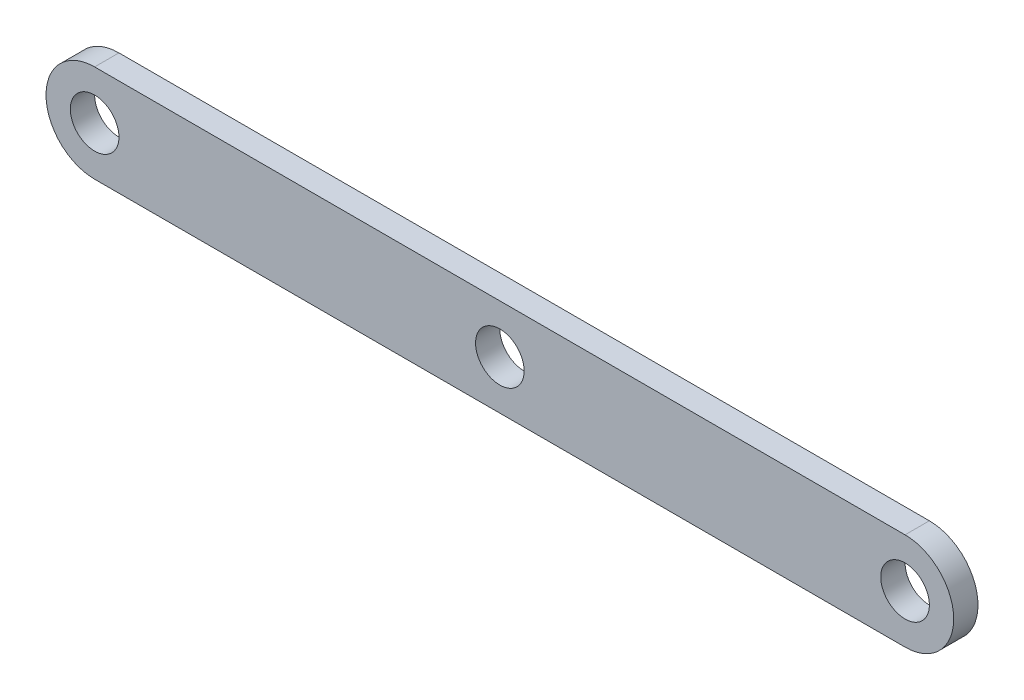
from build123d import *

# Parameters (mm, degrees)
SKETCH1_R           = 3
BOSS_EXTRUDE1_DEPTH = 3


with BuildPart() as part:
    # Sketch1 → Boss-Extrude1 (new body)
    with BuildSketch(Plane.XY):
        with BuildLine():
            Line((-50, 6), (50, 6))
            ThreePointArc((50, 6), (56, 0), (50, -6))
            Line((50, -6), (-50, -6))
            ThreePointArc((-50, -6), (-56, 0), (-50, 6))
        make_face()
        with Locations((-50, 0)):
            Circle(SKETCH1_R, mode=Mode.SUBTRACT)
        with Locations((50, 0)):
            Circle(SKETCH1_R, mode=Mode.SUBTRACT)
        Circle(SKETCH1_R, mode=Mode.SUBTRACT)
    extrude(amount=BOSS_EXTRUDE1_DEPTH)


solid = part.part
